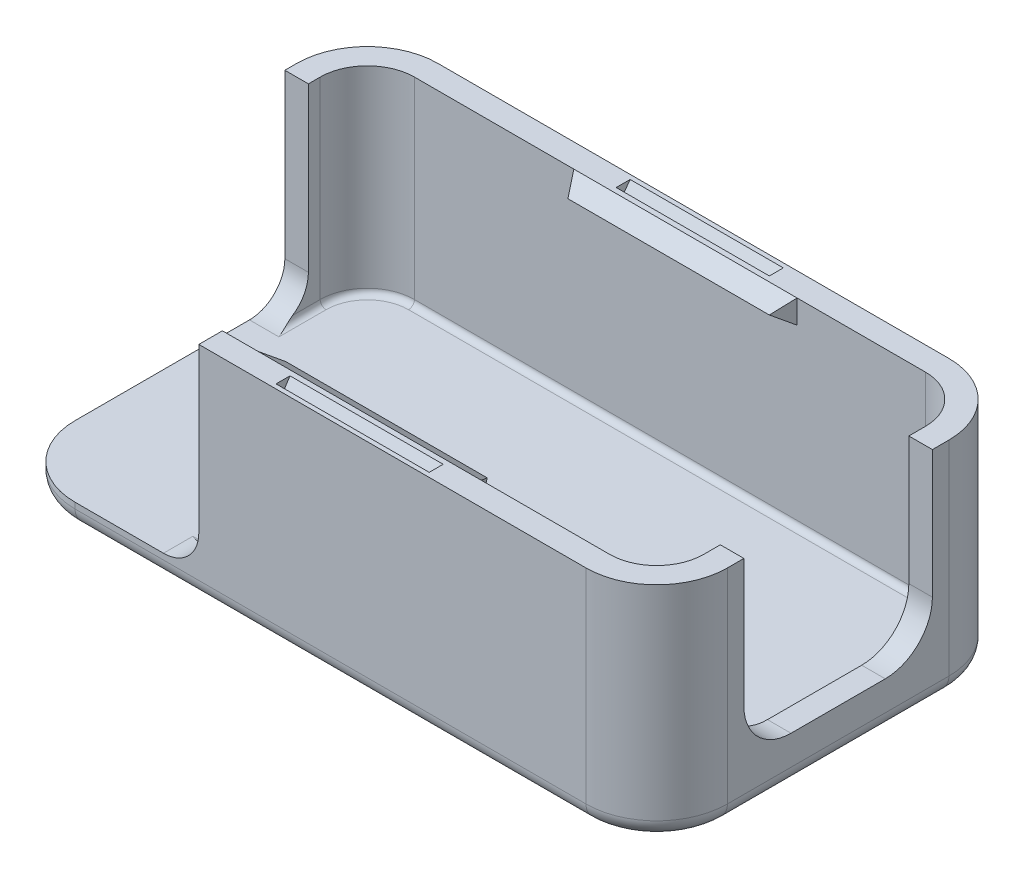
from build123d import *
from OCP.BRepFilletAPI import BRepFilletAPI_MakeFillet

# Parameters (mm, degrees)
SKETCH1_W               = 55.36
SKETCH1_H               = 30.8
BOSS_EXTRUDE1_DEPTH     = 2
SKETCH3_W               = 2
SKETCH3_H               = 5
BOSS_EXTRUDE3_DEPTH     = 16.85
SKETCH5_W               = 16
SKETCH5_H               = 20
CUT_EXTRUDE1_DEPTH      = 37.860071894
FILLET1_R1              = 6
FILLET1_R2              = 4
FILLET2_R               = 1.5
BOSS_EXTRUDE4_START     = -3
BOSS_EXTRUDE4_DEPTH     = 17
CHAMFER1_SIZE           = 0.97411139
CHAMFER1_SIZE_2         = 1.5
FILLET6_R               = 0.5
FILLET7_R               = 4
CUT_EXTRUDE2_DEPTH      = 8
CUT_EXTRUDE2_DEPTH_BACK = 5
FILLET8_START           = -27.68
FILLET8_DEPTH           = 2
FILLET8_START_2         = 12.8999999
FILLET8_2_DEPTH         = 2.5000001
FILLET8_START_3         = -8.4
FILLET8_3_DEPTH         = 3.0000001
FILLET8_START_4         = -25.68
FILLET8_4_DEPTH         = 14.5


with BuildPart() as part:
    # Sketch1 → Boss-Extrude1 (new body)
    with BuildSketch(Plane(origin=(0, 0, 0), x_dir=(1, 0, 0), z_dir=(0, 1, 0))):
        Rectangle(SKETCH1_W, SKETCH1_H)
    extrude(amount=BOSS_EXTRUDE1_DEPTH)

    # Sketch3 → Boss-Extrude3 (add)
    with BuildSketch(Plane(origin=(0, 2, 0), x_dir=(1, 0, 0), z_dir=(0, 1, 0))):
        with Locations((-26.68, 10.9)):
            Rectangle(SKETCH3_W, SKETCH3_H)
        Polygon((-27.68, 15.4), (-27.68, 13.4), (-25.68, 13.4), (25.68, 13.4), (25.68, -13.4), (-11.18, -13.4), (-11.18, -15.4), (27.68, -15.4), (27.68, 15.4), align=None)
    extrude(amount=BOSS_EXTRUDE3_DEPTH)

    # Sketch5 → Cut-Extrude1 (cut, through all)
    with BuildSketch(Plane(origin=(0, 0, 0), x_dir=(0, 0, -1), z_dir=(1, 0, 0))):
        with Locations((0, 14)):
            Rectangle(SKETCH5_W, SKETCH5_H)
    extrude(amount=CUT_EXTRUDE1_DEPTH, mode=Mode.SUBTRACT)

    # Fillet1: one fillet with a radius per group of edges: ONE call of the kernel's fillet builder (fillet() takes one radius for all edges)
    fillet1_edges_1 = [part.edges().sort_by_distance(p)[0] for p in [
        (27.68, 9.425, -15.4),
        (27.68, 9.425, 15.4),
        (-27.68, 9.425, -15.4),
        (-27.68, 1, 15.4),
    ]]
    fillet1_edges_2 = [part.edges().sort_by_distance(p)[0] for p in [
        (25.68, 10.425, -13.4),
        (25.68, 10.425, 13.4),
        (-25.68, 10.425, -13.4),
    ]]
    fillet1 = BRepFilletAPI_MakeFillet(part.part.solid().wrapped)
    for e in fillet1_edges_1:
        fillet1.Add(FILLET1_R1, e.wrapped)
    for e in fillet1_edges_2:
        fillet1.Add(FILLET1_R2, e.wrapped)
    add(Compound.cast(fillet1.Shape()), mode=Mode.REPLACE)

    # Fillet2
    fillet2_edges = [part.edges().sort_by_distance(p)[0] for p in [
        (0, 0, 15.4),
        (27.68, 0, 0),
        (-27.68, 0, 0),
        (0, 0, -15.4),
        (25.922640687, 0, -13.642640687),
        (25.922640687, 0, 13.642640687),
        (-25.922640687, 0, -13.642640687),
        (-25.922640687, 0, 13.642640687),
    ]]
    fillet(fillet2_edges, radius=FILLET2_R)

    # Sketch4 → Boss-Extrude4 (add)
    with BuildSketch(Plane.ZY.offset(10.18).offset(BOSS_EXTRUDE4_START)):
        Polygon((-13.4, 18.85), (-11.971851993, 17.85), (-13.4, 16.85), align=None)
        Polygon((13.4, 18.85), (11.971851993, 17.85), (13.4, 16.85), align=None)
    extrude(amount=-BOSS_EXTRUDE4_DEPTH)

    # Chamfer1
    # the kernel refuses this chamfer: 1.5, 0.97411139 mm, written as the material it adds along each edge
    with BuildSketch(Plane(origin=(9.82, 12.9733385, 13.4), x_dir=(1, 0, 0), z_dir=(0, 1, 0))) as chamfer1_piece_1_section:
        Polygon((CHAMFER1_SIZE, 0), (0, CHAMFER1_SIZE_2), (0, 0), align=None)
    chamfer1_piece_1 = extrude(amount=5.8766615, mode=Mode.PRIVATE)
    chamfer1_piece_1 = split(chamfer1_piece_1, bisect_by=Plane(origin=(9.82, 15.574617411, 15.221435103), z_dir=(0, 0.8191520442889897, 0.5735764363510492)), keep=Keep.TOP, mode=Mode.PRIVATE)
    chamfer1_piece_1 = split(chamfer1_piece_1, bisect_by=Plane(origin=(9.82, 16.916637554, 10.638872277), z_dir=(0, -0.8191520442889973, 0.5735764363510382)), keep=Keep.TOP, mode=Mode.PRIVATE)
    add(chamfer1_piece_1)
    with BuildSketch(Plane(origin=(-7.18, 12.9733385, 13.4), x_dir=(-1, 0, 0), z_dir=(0, 1, 0))) as chamfer1_piece_2_section:
        Polygon((CHAMFER1_SIZE, 0), (0, -CHAMFER1_SIZE_2), (0, 0), align=None)
    chamfer1_piece_2 = extrude(amount=5.8766615, mode=Mode.PRIVATE)
    chamfer1_piece_2 = split(chamfer1_piece_2, bisect_by=Plane(origin=(-7.18, 15.574617411, 15.221435103), z_dir=(0, 0.8191520442889897, 0.5735764363510492)), keep=Keep.TOP, mode=Mode.PRIVATE)
    chamfer1_piece_2 = split(chamfer1_piece_2, bisect_by=Plane(origin=(-7.18, 16.916637554, 10.638872277), z_dir=(0, -0.8191520442889973, 0.5735764363510382)), keep=Keep.TOP, mode=Mode.PRIVATE)
    add(chamfer1_piece_2)
    with BuildSketch(Plane(origin=(9.82, 12.9733385, -13.4), x_dir=(1, 0, 0), z_dir=(0, 1, 0))) as chamfer1_piece_3_section:
        Polygon((CHAMFER1_SIZE, 0), (0, -CHAMFER1_SIZE_2), (0, 0), align=None)
    chamfer1_piece_3 = extrude(amount=5.8766615, mode=Mode.PRIVATE)
    chamfer1_piece_3 = split(chamfer1_piece_3, bisect_by=Plane(origin=(9.82, 15.574617411, -15.221435103), z_dir=(0, 0.8191520442889897, -0.5735764363510492)), keep=Keep.TOP, mode=Mode.PRIVATE)
    chamfer1_piece_3 = split(chamfer1_piece_3, bisect_by=Plane(origin=(9.82, 16.916637554, -10.638872277), z_dir=(0, -0.8191520442889973, -0.5735764363510382)), keep=Keep.TOP, mode=Mode.PRIVATE)
    add(chamfer1_piece_3)
    with BuildSketch(Plane(origin=(-7.18, 12.9733385, -13.4), x_dir=(-1, 0, 0), z_dir=(0, 1, 0))) as chamfer1_piece_4_section:
        Polygon((CHAMFER1_SIZE, 0), (0, CHAMFER1_SIZE_2), (0, 0), align=None)
    chamfer1_piece_4 = extrude(amount=5.8766615, mode=Mode.PRIVATE)
    chamfer1_piece_4 = split(chamfer1_piece_4, bisect_by=Plane(origin=(-7.18, 15.574617411, -15.221435103), z_dir=(0, 0.8191520442889897, -0.5735764363510492)), keep=Keep.TOP, mode=Mode.PRIVATE)
    chamfer1_piece_4 = split(chamfer1_piece_4, bisect_by=Plane(origin=(-7.18, 16.916637554, -10.638872277), z_dir=(0, -0.8191520442889973, -0.5735764363510382)), keep=Keep.TOP, mode=Mode.PRIVATE)
    add(chamfer1_piece_4)

    # Fillet6
    fillet6_edges = [part.edges().sort_by_distance(p)[0] for p in [
        (-25.68, 2, -8.9),
        (5.25, 2, 13.4),
        (0, 2, -13.4),
        (25.68, 2, 0),
        (24.508427125, 2, -12.228427125),
        (24.508427125, 2, 12.228427125),
        (-24.508427125, 2, -12.228427125),
    ]]
    fillet(fillet6_edges, radius=FILLET6_R)

    # Fillet7
    fillet7_edges = [part.edges().sort_by_distance(p)[0] for p in [
        (26.68, 4, -8),
        (26.68, 4, 8),
    ]]
    fillet(fillet7_edges, radius=FILLET7_R)

    # Sketch6 → Cut-Extrude2 (cut, two sides: drawn at the far end of the back side and taken through both)
    with BuildSketch(Plane(origin=(0, 0, 0), x_dir=(0, 0, -1), z_dir=(1, 0, 0)).offset(-CUT_EXTRUDE2_DEPTH_BACK)):
        Polygon((-15.025755833, 18.85), (-14.4, 17.97951196), (-13.841478047, 18.85), align=None)
        Polygon((13.841478047, 18.85), (15.025755833, 18.85), (14.4, 17.97951196), align=None)
    extrude(amount=CUT_EXTRUDE2_DEPTH + CUT_EXTRUDE2_DEPTH_BACK, mode=Mode.SUBTRACT)

    # Fillet8: read off the stored shape, not the designer's step
    # Fillet8 outline → Fillet8 (add)
    with BuildSketch(Plane.YZ.offset(FILLET8_START)):
        with BuildLine():
            Line((2, -8.4), (5, -8.4))
            ThreePointArc((5, -8.4), (2.878679656, -7.521320344), (2, -5.4))
            Line((2, -5.4), (2, -8.4))
        make_face()
    extrude(amount=FILLET8_DEPTH)

    # Fillet8 2 outline → Fillet8 2 (add)
    with BuildSketch(Plane.XY.offset(FILLET8_START_2)):
        with BuildLine():
            ThreePointArc((-11.18, 5), (-12.058679656, 2.878679656), (-14.18, 2))
            Line((-14.18, 2), (-11.18, 2))
            Line((-11.18, 2), (-11.18, 5))
        make_face()
    extrude(amount=FILLET8_2_DEPTH)

    # Fillet8 3 outline → Fillet8 3 (add)
    with BuildSketch(Plane.XY.offset(FILLET8_START_3)):
        with BuildLine():
            ThreePointArc((-25.18, 2), (-25.533553391, 2.146446609), (-25.68, 2.5))
            Line((-25.68, 2.5), (-25.68, 2))
            Line((-25.68, 2), (-25.18, 2))
        make_face()
    extrude(amount=FILLET8_3_DEPTH)

    # Fillet8 4 outline → Fillet8 4 (cut)
    with BuildSketch(Plane.YZ.offset(FILLET8_START_4)):
        with BuildLine():
            ThreePointArc((2.5, 13.4), (2.146446609, 13.253553391), (2, 12.9))
            Line((2, 12.9), (5, 12.8999999))
            Line((5, 12.8999999), (5, 13.4))
            Line((5, 13.4), (2.5, 13.4))
        make_face()
        with BuildLine():
            ThreePointArc((2, -5.4), (2.127718677, -6.266025404), (2.5, -7.058312396))
            Line((2.5, -7.058312396), (2.5, -5.3999999))
            Line((2.5, -5.3999999), (2, -5.4))
        make_face()
    extrude(amount=FILLET8_4_DEPTH, mode=Mode.SUBTRACT)


solid = part.part
